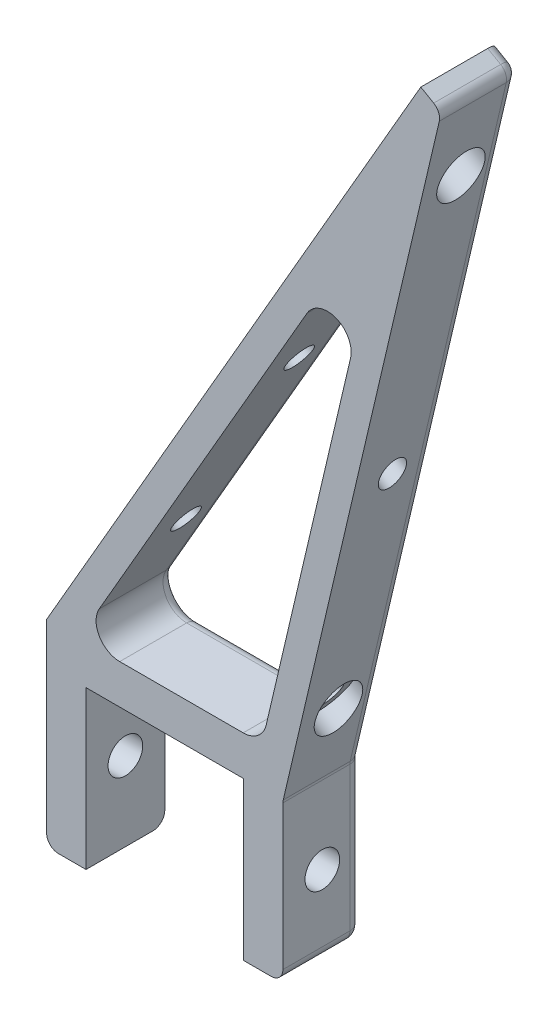
from build123d import *

# Parameters (mm, degrees)
BOSS_EXTRUDE1_DEPTH = 10
CUT_EXTRUDE1_DEPTH  = 95.596978287
FILLET1_R           = 3
FILLET2_R           = 1.5
SKETCH3_R           = 2.2
CUT_EXTRUDE2_DEPTH  = 102.020680113
SKETCH4_R           = 1.75
CUT_EXTRUDE3_DEPTH  = 94.58236857
CUT_EXTRUDE4_START  = 3
SKETCH5_R           = 3
CUT_EXTRUDE4_DEPTH  = 91.712514751
CUT_EXTRUDE5_START  = -24.38
SKETCH6_R           = 3
CUT_EXTRUDE5_DEPTH  = 70.20236857


with BuildPart() as part:
    # Sketch1 → Boss-Extrude1 (new body)
    with BuildSketch(Plane.XY):
        Polygon((-10, -20), (-10, 0), (10, 0), (10, -20), (15, -20), (15, 0), (35.101483834, 85.770445967), (32.5, 87.27241336), (-15, 5), (-15, -20), align=None)
    extrude(amount=BOSS_EXTRUDE1_DEPTH)

    # Sketch2 → Cut-Extrude1 (cut, through all)
    with BuildSketch(Plane.XY.offset(10)):
        Polygon((-10.917498512, 5), (28.214788811, 72.779109859), (12.329822075, 5), align=None)
    extrude(amount=-CUT_EXTRUDE1_DEPTH, mode=Mode.SUBTRACT)

    # Fillet1
    fillet1_edges = [part.edges().sort_by_distance(p)[0] for p in [
        (-10.917498512, 5, 5),
        (12.329822075, 5, 5),
        (28.214788811, 72.779109859, 5),
    ]]
    fillet(fillet1_edges, radius=FILLET1_R)

    # Fillet2
    fillet2_edges = [part.edges().sort_by_distance(p)[0] for p in [
        (35.101483834, 85.770445967, 5),
        (15, 0, 5),
        (15, -20, 5),
        (-15, -20, 5),
        (-8.3194223, 6.5, 0),
        (4.871758353, 32.347795103, 0),
        (21.765145456, 56.485016027, 0),
        (18.227176379, 30.163252268, 0),
        (11.815273588, 5.649082253, 0),
        (33.800741917, 86.521429663, 0),
        (25.050741917, 42.885222984, 0),
        (15, -10, 0),
        (12.5, -20, 0),
        (-15, -7.5, 0),
        (-12.5, -20, 0),
        (2.115139497, 5, 0),
    ]]
    fillet(fillet2_edges, radius=FILLET2_R)

    # Sketch3 → Cut-Extrude2 (cut, through all)
    with BuildSketch(Plane.ZY.offset(15)):
        with Locations((5, -10)):
            Circle(SKETCH3_R)
    extrude(amount=-CUT_EXTRUDE2_DEPTH, mode=Mode.SUBTRACT)

    # Sketch4 → Cut-Extrude3 (cut, through all)
    with BuildSketch(Plane(origin=(-13.415063509, 7.745190528, 0), x_dir=(0, 0, 1), z_dir=(-0.866025403784438, 0.5000000000000009, 0))):
        with Locations((5, 81.330127019)):
            Circle(SKETCH4_R)
        with Locations((5, 44.830127019)):
            Circle(SKETCH4_R)
        with Locations((5, 16.098937019)):
            Circle(SKETCH4_R)
    extrude(amount=-CUT_EXTRUDE3_DEPTH, mode=Mode.SUBTRACT)

    # Sketch5 → Cut-Extrude4 (cut, through all)
    with BuildSketch(Plane(origin=(-13.480526942, 7.631804537, 0), x_dir=(0, 0, -1), z_dir=(0.8660254037844382, -0.500000000000001, 0)).offset(CUT_EXTRUDE4_START)):
        with Locations((-5, 81.461053884)):
            Circle(SKETCH5_R)
    extrude(amount=CUT_EXTRUDE4_DEPTH, mode=Mode.SUBTRACT)

    # Sketch6 → Cut-Extrude5 (cut, through all)
    with BuildSketch(Plane(origin=(-13.415063509, 7.745190528, 0), x_dir=(0, 0, 1), z_dir=(-0.866025403784438, 0.5000000000000009, 0)).offset(CUT_EXTRUDE5_START)):
        with Locations((5, 16.098937019)):
            Circle(SKETCH6_R)
    extrude(amount=-CUT_EXTRUDE5_DEPTH, mode=Mode.SUBTRACT)


solid = part.part
